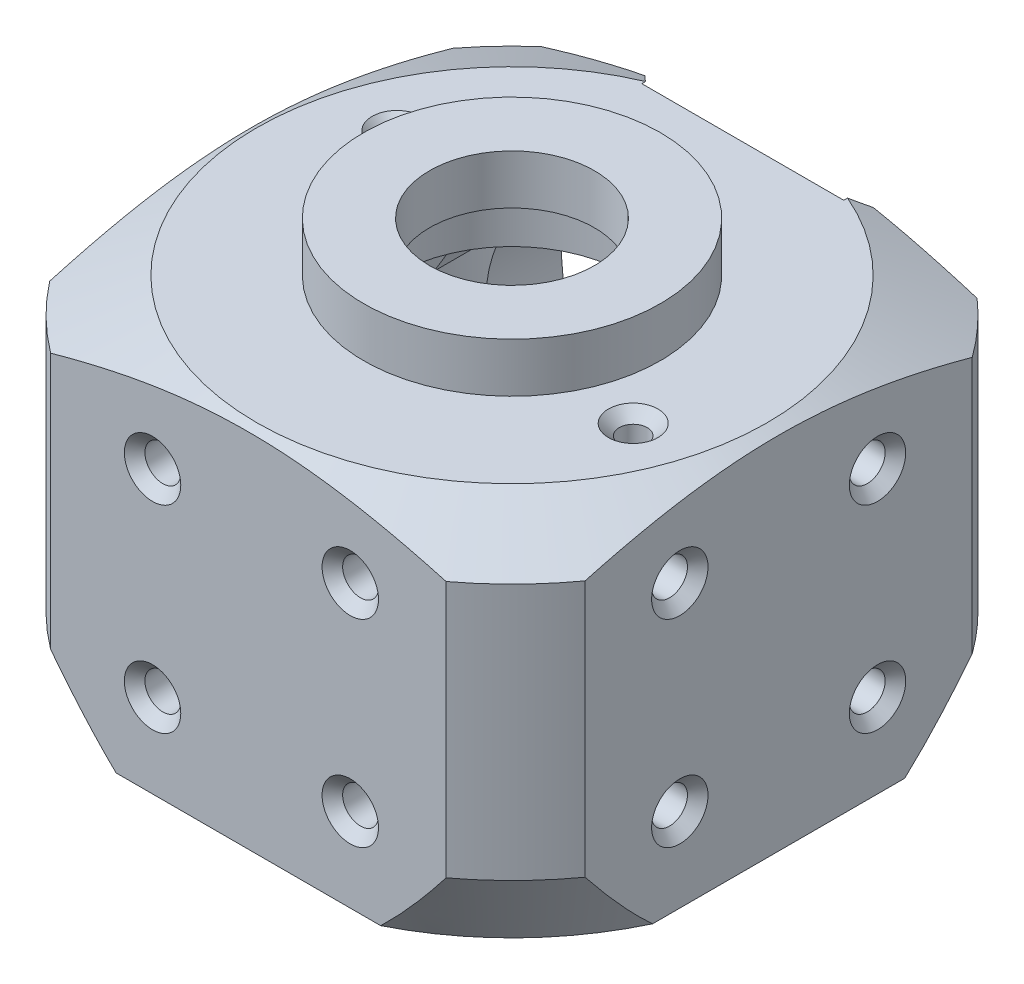
from build123d import *

# Parameters (mm, degrees)
SKETCH1_W                       = 50.8
SKETCH1_H                       = 49.2125
BOSS_EXTRUDE1_DEPTH             = 35.2044
SKETCH2_R                       = 14.2875
BOSS_EXTRUDE2_DEPTH             = 4.7625
SKETCH4_R                       = 12.122727273
CUT_EXTRUDE1_DEPTH              = 7.9375
SKETCH5_R                       = 20.2438
CUT_EXTRUDE2_DEPTH              = 1.5748
SKETCH6_R                       = 13.8938
CUT_EXTRUDE3_DEPTH              = 4.7498
CUT_EXTRUDE4_REACH              = 70.296
CUT_EXTRUDE4_DIRECTION_2_DEPTH  = 69.296290176
F_6_32_TAPPED_HOLE1_D           = 2.7051
F_6_32_TAPPED_HOLE1_DEPTH       = 4.064
F_6_32_TAPPED_HOLE1_CSINK_D     = 4.7752
F_6_32_TAPPED_HOLE1_CSINK_ANGLE = 90
F_6_32_TAPPED_HOLE1_TIP         = 0.81269403
F_8_32_TAPPED_HOLE1_D           = 3.4544
F_8_32_TAPPED_HOLE1_DEPTH       = 6.35
F_8_32_TAPPED_HOLE1_CSINK_D     = 5.4356
F_8_32_TAPPED_HOLE1_CSINK_ANGLE = 90
F_8_32_TAPPED_HOLE1_TIP         = 1.037806461
F_8_32_TAPPED_HOLE2_D           = 3.4544
F_8_32_TAPPED_HOLE2_DEPTH       = 6.35
F_8_32_TAPPED_HOLE2_CSINK_D     = 5.4356
F_8_32_TAPPED_HOLE2_CSINK_ANGLE = 90
F_8_32_TAPPED_HOLE2_TIP         = 1.037806461
F_8_32_TAPPED_HOLE3_D           = 3.4544
F_8_32_TAPPED_HOLE3_DEPTH       = 6.35
F_8_32_TAPPED_HOLE3_CSINK_D     = 5.4356
F_8_32_TAPPED_HOLE3_CSINK_ANGLE = 90
F_8_32_TAPPED_HOLE3_TIP         = 1.037806461
F_6_32_TAPPED_HOLE2_D           = 2.7051
F_6_32_TAPPED_HOLE2_DEPTH       = 7.874
F_6_32_TAPPED_HOLE2_CSINK_D     = 4.7752
F_6_32_TAPPED_HOLE2_CSINK_ANGLE = 90
F_6_32_TAPPED_HOLE2_TIP         = 0.81269403
F_2_56_TAPPED_HOLE1_D           = 1.778
F_2_56_TAPPED_HOLE1_DEPTH       = 4.064
F_2_56_TAPPED_HOLE1_CSINK_D     = 3.4544
F_2_56_TAPPED_HOLE1_CSINK_ANGLE = 90
F_2_56_TAPPED_HOLE1_TIP         = 0.53416509
F_6_32_TAPPED_HOLE3_D           = 2.7051
F_6_32_TAPPED_HOLE3_DEPTH       = 4.826
F_6_32_TAPPED_HOLE3_CSINK_D     = 4.7752
F_6_32_TAPPED_HOLE3_CSINK_ANGLE = 90
F_6_32_TAPPED_HOLE3_TIP         = 0.81269403
CUT_EXTRUDE5_DEPTH              = 51.295822753


with BuildPart() as part:
    # Sketch1 → Boss-Extrude1 (new body)
    with BuildSketch(Plane(origin=(0, 0, 0), x_dir=(1, 0, 0), z_dir=(0, 1, 0))):
        with Locations((0, -0.79375)):
            Rectangle(SKETCH1_W, SKETCH1_H)
    extrude(amount=BOSS_EXTRUDE1_DEPTH)

    # Sketch2 → Boss-Extrude2 (add)
    with BuildSketch(Plane(origin=(0, 35.2044, 0), x_dir=(1, 0, 0), z_dir=(0, 1, 0))):
        with Locations(Location((-0.293167428, 0, 0), (0, 0, 90))):
            Circle(SKETCH2_R)
    extrude(amount=BOSS_EXTRUDE2_DEPTH)

    # Sketch3 → Cut-Revolve1 (revolve, cut)
    with BuildSketch(Plane(origin=(-0.293167428, 0, 0), x_dir=(0, 0, -1), z_dir=(1, 0, 0)), mode=Mode.PRIVATE) as cut_revolve1_sk:
        Polygon((0, 39.9669), (7.9375, 39.9669), (7.9375, 35.2044), (11.1125, 35.2044), (11.1125, 29.7434), (17.4625, 29.7434), (17.4625, 27.8384), (19.05, 27.8384), (19.05, 22.621875), (23.01875, 22.621875), (23.01875, 12.303125), (19.05, 12.303125), (19.05, 0), (0, 0), align=None)
    revolve(cut_revolve1_sk.sketch.rotate(Axis((-0.293167428, 39.9669, 0), (0, -1, 0)), 180), axis=Axis((-0.293167428, 39.9669, 0), (0, -1, 0)), mode=Mode.SUBTRACT)

    # Sketch4 → Cut-Extrude1 (cut)
    with BuildSketch(Plane(origin=(0, 0, -23.8125), x_dir=(-1, 0, 0), z_dir=(0, 0, -1))):
        with Locations((0.293167428, 17.4498)):
            Circle(SKETCH4_R)
    extrude(amount=-CUT_EXTRUDE1_DEPTH, mode=Mode.SUBTRACT)

    # Sketch5 → Cut-Extrude2 (cut)
    with BuildSketch(Plane(origin=(0, 0, -23.8125), x_dir=(-1, 0, 0), z_dir=(0, 0, -1))):
        with Locations((0.293167428, 17.4498)):
            Circle(SKETCH5_R)
    extrude(amount=-CUT_EXTRUDE2_DEPTH, mode=Mode.SUBTRACT)

    # Sketch6 → Cut-Extrude3 (cut)
    with BuildSketch(Plane(origin=(0, 0, -23.8125), x_dir=(-1, 0, 0), z_dir=(0, 0, -1))):
        with Locations((0.293167428, 17.4498)):
            Circle(SKETCH6_R)
    extrude(amount=-CUT_EXTRUDE3_DEPTH, mode=Mode.SUBTRACT)

    # Sketch7 → Cut-Extrude4 (cut, up to next)
    with BuildSketch(Plane(origin=(0, 0, -23.8125), x_dir=(-1, 0, 0), z_dir=(0, 0, -1)), mode=Mode.PRIVATE) as cut_extrude4_sk1:
        with BuildLine():
            Line((0.293167428, 25.3873), (15.847427294, 25.3873))
            ThreePointArc((15.847427294, 25.3873), (17.755667428, 17.4498), (15.847427294, 9.5123))
            Line((15.847427294, 9.5123), (0.293167428, 9.5123))
            Line((0.293167428, 9.5123), (0.293167428, 25.3873))
        make_face()
    cut_extrude4_tool1 = extrude(cut_extrude4_sk1.sketch, amount=-CUT_EXTRUDE4_REACH, mode=Mode.PRIVATE) & part.part
    add(cut_extrude4_tool1.solids().sort_by_distance((-8.723115, 17.4498, -23.8125))[0], mode=Mode.SUBTRACT)

    # Sketch7 → Cut-Extrude4 direction 2 (cut)
    with BuildSketch(Plane(origin=(0, 0, -23.8125), x_dir=(-1, 0, 0), z_dir=(0, 0, -1))):
        with BuildLine():
            Line((0.293167428, 25.3873), (15.847427294, 25.3873))
            ThreePointArc((15.847427294, 25.3873), (17.755667428, 17.4498), (15.847427294, 9.5123))
            Line((15.847427294, 9.5123), (0.293167428, 9.5123))
            Line((0.293167428, 9.5123), (0.293167428, 25.3873))
        make_face()
    extrude(amount=CUT_EXTRUDE4_DIRECTION_2_DEPTH, mode=Mode.SUBTRACT)

    # #6-32 Tapped Hole1
    with Locations(Plane(origin=(0, 35.2044, 0), x_dir=(1, 0, 0), z_dir=(0, 1, 0))):
        with Locations((-17.901144426, 6.51548373), (17.901144426, -6.51548373)):
            CounterSinkHole(F_6_32_TAPPED_HOLE1_D / 2, F_6_32_TAPPED_HOLE1_CSINK_D / 2, depth=F_6_32_TAPPED_HOLE1_DEPTH, counter_sink_angle=F_6_32_TAPPED_HOLE1_CSINK_ANGLE)
            with Locations((0, 0, -(F_6_32_TAPPED_HOLE1_DEPTH + F_6_32_TAPPED_HOLE1_TIP / 2))):  # 118° drill point
                Cone(0, F_6_32_TAPPED_HOLE1_D / 2, F_6_32_TAPPED_HOLE1_TIP, mode=Mode.SUBTRACT)

    # #8-32 Tapped Hole1
    with Locations(Plane(origin=(25.4, 0, 0), x_dir=(0, 0, -1), z_dir=(1, 0, 0))):
        with Locations((9.525, 8.0772), (9.525, 27.1272), (-9.525, 27.1272), (-9.525, 8.0772)):
            CounterSinkHole(F_8_32_TAPPED_HOLE1_D / 2, F_8_32_TAPPED_HOLE1_CSINK_D / 2, depth=F_8_32_TAPPED_HOLE1_DEPTH, counter_sink_angle=F_8_32_TAPPED_HOLE1_CSINK_ANGLE)
            with Locations((0, 0, -(F_8_32_TAPPED_HOLE1_DEPTH + F_8_32_TAPPED_HOLE1_TIP / 2))):  # 118° drill point
                Cone(0, F_8_32_TAPPED_HOLE1_D / 2, F_8_32_TAPPED_HOLE1_TIP, mode=Mode.SUBTRACT)

    # #8-32 Tapped Hole2
    with Locations(Plane.XY.offset(25.4)):
        with Locations((-9.525, 8.0772), (-9.525, 27.1272), (9.525, 27.1272), (9.525, 8.0772)):
            CounterSinkHole(F_8_32_TAPPED_HOLE2_D / 2, F_8_32_TAPPED_HOLE2_CSINK_D / 2, depth=F_8_32_TAPPED_HOLE2_DEPTH, counter_sink_angle=F_8_32_TAPPED_HOLE2_CSINK_ANGLE)
            with Locations((0, 0, -(F_8_32_TAPPED_HOLE2_DEPTH + F_8_32_TAPPED_HOLE2_TIP / 2))):  # 118° drill point
                Cone(0, F_8_32_TAPPED_HOLE2_D / 2, F_8_32_TAPPED_HOLE2_TIP, mode=Mode.SUBTRACT)

    # #8-32 Tapped Hole3
    with Locations(Plane.ZY.offset(25.4)):
        with Locations((-9.525, 8.0772), (-9.525, 27.1272), (9.525, 27.1272), (9.525, 8.0772)):
            CounterSinkHole(F_8_32_TAPPED_HOLE3_D / 2, F_8_32_TAPPED_HOLE3_CSINK_D / 2, depth=F_8_32_TAPPED_HOLE3_DEPTH, counter_sink_angle=F_8_32_TAPPED_HOLE3_CSINK_ANGLE)
            with Locations((0, 0, -(F_8_32_TAPPED_HOLE3_DEPTH + F_8_32_TAPPED_HOLE3_TIP / 2))):  # 118° drill point
                Cone(0, F_8_32_TAPPED_HOLE3_D / 2, F_8_32_TAPPED_HOLE3_TIP, mode=Mode.SUBTRACT)

    # #6-32 Tapped Hole2
    with Locations(Plane(origin=(0, 0, 0), x_dir=(-1, 0, 0), z_dir=(0, -1, 0))):
        with Locations((16.307303522, 16.008564144), (16.008615639, -15.715448212), (-15.715396716, -15.41676033), (-15.416708834, 16.307252026)):
            CounterSinkHole(F_6_32_TAPPED_HOLE2_D / 2, F_6_32_TAPPED_HOLE2_CSINK_D / 2, depth=F_6_32_TAPPED_HOLE2_DEPTH, counter_sink_angle=F_6_32_TAPPED_HOLE2_CSINK_ANGLE)
            with Locations((0, 0, -(F_6_32_TAPPED_HOLE2_DEPTH + F_6_32_TAPPED_HOLE2_TIP / 2))):  # 118° drill point
                Cone(0, F_6_32_TAPPED_HOLE2_D / 2, F_6_32_TAPPED_HOLE2_TIP, mode=Mode.SUBTRACT)

    # #2-56 Tapped Hole1
    with Locations(Plane.XZ.offset(-29.7434)):
        with Locations((-10.395955564, -10.102788136), (-10.395955564, 10.102788136), (9.809620709, 10.102788136), (9.809620709, -10.102788136)):
            CounterSinkHole(F_2_56_TAPPED_HOLE1_D / 2, F_2_56_TAPPED_HOLE1_CSINK_D / 2, depth=F_2_56_TAPPED_HOLE1_DEPTH, counter_sink_angle=F_2_56_TAPPED_HOLE1_CSINK_ANGLE)
            with Locations((0, 0, -(F_2_56_TAPPED_HOLE1_DEPTH + F_2_56_TAPPED_HOLE1_TIP / 2))):  # 118° drill point
                Cone(0, F_2_56_TAPPED_HOLE1_D / 2, F_2_56_TAPPED_HOLE1_TIP, mode=Mode.SUBTRACT)

    # #6-32 Tapped Hole3
    with Locations(Plane(origin=(0, 0, -22.2377), x_dir=(-1, 0, 0), z_dir=(0, 0, -1))):
        with Locations((-12.054684739, 29.797652166), (12.641019594, 29.797652166), (12.641019594, 5.101947834), (-12.054684739, 5.101947834)):
            CounterSinkHole(F_6_32_TAPPED_HOLE3_D / 2, F_6_32_TAPPED_HOLE3_CSINK_D / 2, depth=F_6_32_TAPPED_HOLE3_DEPTH, counter_sink_angle=F_6_32_TAPPED_HOLE3_CSINK_ANGLE)
            with Locations((0, 0, -(F_6_32_TAPPED_HOLE3_DEPTH + F_6_32_TAPPED_HOLE3_TIP / 2))):  # 118° drill point
                Cone(0, F_6_32_TAPPED_HOLE3_D / 2, F_6_32_TAPPED_HOLE3_TIP, mode=Mode.SUBTRACT)

    # Sketch23 → Cut-Extrude5 (cut, through all)
    with BuildSketch(Plane(origin=(0, 35.2044, 0), x_dir=(1, 0, 0), z_dir=(0, 1, 0))):
        with BuildLine():
            Line((20.707483604, 23.8125), (25.4, 23.8125))
            Line((25.4, 23.8125), (25.4, 18.652711533))
            ThreePointArc((25.4, 18.652711533), (23.195851812, 21.361846249), (20.707483604, 23.8125))
        make_face()
        with BuildLine():
            Line((25.4, -18.652711533), (25.4, -25.4))
            Line((25.4, -25.4), (18.756832572, -25.4))
            ThreePointArc((18.756832572, -25.4), (22.331359822, -22.275395995), (25.4, -18.652711533))
        make_face()
        with BuildLine():
            Line((-19.343167428, -25.4), (-25.4, -25.4))
            Line((-25.4, -25.4), (-25.4, -19.43474873))
            ThreePointArc((-25.4, -19.43474873), (-22.572137812, -22.621007462), (-19.343167428, -25.4))
        make_face()
        with BuildLine():
            Line((-25.4, 19.43474873), (-25.4, 23.8125))
            Line((-25.4, 23.8125), (-21.293818459, 23.8125))
            ThreePointArc((-21.293818459, 23.8125), (-23.450589297, 21.720872735), (-25.4, 19.43474873))
        make_face()
    extrude(amount=-CUT_EXTRUDE5_DEPTH, mode=Mode.SUBTRACT)

    # Chamfer2: read off the stored shape, not the designer's step
    # Chamfer2 outline → Chamfer2 (revolve, cut)
    with BuildSketch(Plane(origin=(-0.293167428, 0, 0), x_dir=(1, 0, 0), z_dir=(0, 0, 1))):
        Polygon((31.75, 7.14375), (28.418814667, 0), (31.75, 0), align=None)
        Polygon((24.60625, 35.2044), (31.75, 31.873214667), (31.75, 35.2044), align=None)
    revolve(axis=Axis((-0.293167428, 0, 0), (0, 1, 0)), mode=Mode.SUBTRACT)


solid = part.part
